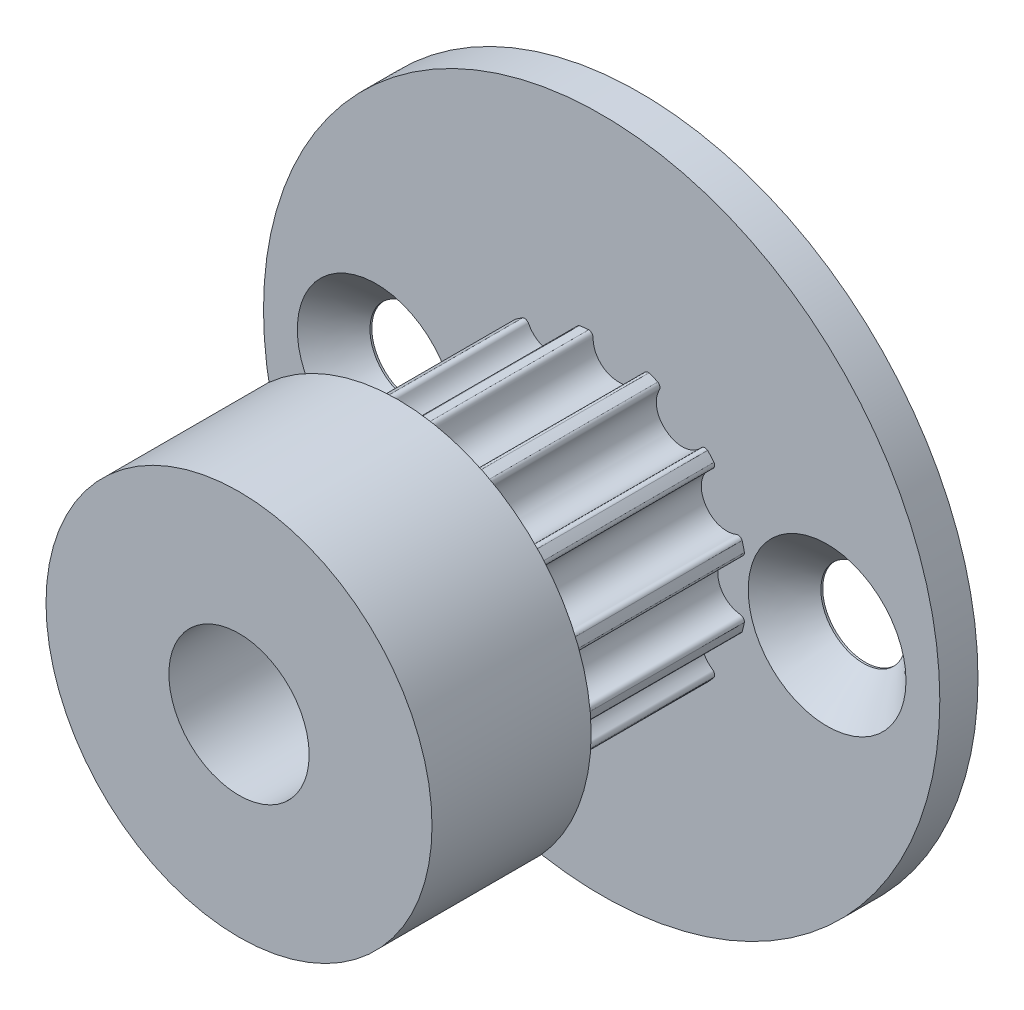
from build123d import *

# Parameters (mm, degrees)
TOOTHEXTRUDECUTGEARBELT01_DEPTH                = 3.75179993
PATTERNGEARBELT01_COUNT                        = 13
BOSS_EXTRUDE2_START                            = -0.903259633
BOSS_EXTRUDE2_OUTLINE_R                        = 7.705197088
BOSS_EXTRUDE2_OUTLINE_R_2                      = 5.190597126
BOSS_EXTRUDE2_DEPTH                            = 0.903259633
SKETCH6_R                                      = 7.705197088
BOSS_EXTRUDE4_DEPTH                            = 5.45
SKETCH8_R                                      = 2.8
CUT_EXTRUDE2_DEPTH                             = 20.3595279
SKETCH10_R                                     = 13.5
SKETCH10_R_2                                   = 1.5
BOSS_EXTRUDE5_DEPTH                            = 1.524
SKETCH10_2_R                                   = 1.5
CUT_EXTRUDE6_DEPTH                             = 1.524
CSK_FOR_M3_FLAT_HEAD_MACHINE_SCREW1_AT_2_COUNT = 2
CSK_FOR_M3_FLAT_HEAD_MACHINE_SCREW1_AT_2_PITCH = 18


# Read off the part's stored shape, not the designer's step: Boss-Extrude2
with BuildPart() as part:
    # SketchRevolveGearBelt01 → GearBelt01 (revolve)
    with BuildSketch(Plane(origin=(0, 0, 0), x_dir=(0, 0, -1), z_dir=(1, 0, 0)), mode=Mode.PRIVATE) as gearbelt01_sk:
        Polygon((5.2757999, 0), (5.2757999, 5.190597126), (4.51379992, 5.190597126), (4.51379992, 6.055025889), (5.07653656, 7.413592317), (4.372540367, 7.705197088), (3.75179993, 6.206597107), (3.75179993, 5.825597113), (-3.75179993, 5.825597113), (-3.75179993, 6.206597107), (-4.372540367, 7.705197088), (-5.07653656, 7.413592317), (-4.51379992, 6.055025889), (-4.51379992, 5.190597126), (-5.2757999, 5.190597126), (-5.2757999, 0), align=None)
    revolve(gearbelt01_sk.sketch.rotate(Axis((0, 0, 0), (0, 0, -1)), 90), axis=Axis((0, 0, 0), (0, 0, -1)))

    # SketchToothGearBelt01 → ToothExtrudeCutGearBelt01 (cut, symmetric)
    with BuildSketch(Plane.XY):
        with BuildLine():
            ThreePointArc((5.694892079, 1.238985826), (5.82811133, 0), (5.694892079, -1.238985826))
            add(Edge.make_bspline(
                [(5.694892079, -1.238985826), (5.697177057, -1.228489495), (5.699194946, -1.212438974), (5.699015589, -1.190934318), (5.697447837, -1.174881659), (5.694459096, -1.159031946), (5.690073082, -1.143510711), (5.684324518, -1.128440876), (5.677258937, -1.113941791), (5.668932293, -1.100128287), (5.659410534, -1.087109759), (5.648769066, -1.07498933), (5.637092178, -1.063862917), (5.624472313, -1.053818916), (5.611009544, -1.044935833), (5.596810022, -1.03728791), (5.58198796, -1.030921195), (5.566654196, -1.025940308), (5.55095461, -1.022182426), (5.517566972, -1.018537534), (5.464967856, -1.005661424), (5.391433133, -0.99322849), (5.316880193, -0.971191628), (5.244078819, -0.944232687), (5.173663428, -0.911435203), (5.106015211, -0.873290054), (5.04156233, -0.829953387), (4.980696233, -0.781711646), (4.923790969, -0.728854955), (4.87119508, -0.671708794), (4.823231033, -0.610623043), (4.780192773, -0.545972238), (4.74234423, -0.478152621), (4.709916952, -0.407579931), (4.683111362, -0.334686642), (4.662085571, -0.259919934), (4.646991584, -0.183736684), (4.637835603, -0.106609111), (4.635765562, -0.050027961), (4.635859666, -0.014500084), (4.635846864, 0), (4.635859666, 0.014500084), (4.635765562, 0.050027961), (4.637835603, 0.106609111), (4.646991584, 0.183736684), (4.662085571, 0.259919934), (4.683111362, 0.334686642), (4.709916952, 0.407579931), (4.74234423, 0.478152621), (4.780192773, 0.545972238), (4.823231033, 0.610623043), (4.87119508, 0.671708794), (4.923790969, 0.728854955), (4.980696233, 0.781711646), (5.04156233, 0.829953387), (5.106015211, 0.873290054), (5.173663428, 0.911435203), (5.244078819, 0.944232687), (5.316880193, 0.971191628), (5.391433133, 0.99322849), (5.464967856, 1.005661424), (5.517566972, 1.018537534), (5.55095461, 1.022182426), (5.566654196, 1.025940308), (5.58198796, 1.030921195), (5.596810022, 1.03728791), (5.611009544, 1.044935833), (5.624472313, 1.053818916), (5.637092178, 1.063862917), (5.648769066, 1.07498933), (5.659410534, 1.087109759), (5.668932293, 1.100128287), (5.677258937, 1.113941791), (5.684324518, 1.128440876), (5.690073082, 1.143510711), (5.694459096, 1.159031946), (5.697447837, 1.174881659), (5.699015589, 1.190934318), (5.699194946, 1.212438974), (5.697177057, 1.228489495), (5.694892079, 1.238985826)],
                knots=[0, 0, 0, 0, 0.008948615, 0.013422922, 0.01789723, 0.022371537, 0.026845844, 0.031320152, 0.035794459, 0.040268767, 0.044743074, 0.049217381, 0.053691689, 0.058165996, 0.062640304, 0.067114611, 0.071588919, 0.076063226, 0.080537533, 0.085011841, 0.104016804, 0.125568346, 0.147119888, 0.168671431, 0.190222973, 0.211774515, 0.233326058, 0.2548776, 0.276429142, 0.297980685, 0.319532227, 0.341083769, 0.362635312, 0.384186854, 0.405738396, 0.427289939, 0.448841481, 0.470393024, 0.491944566, 0.495972283, 0.5, 0.504027717, 0.508055434, 0.529606976, 0.551158519, 0.572710061, 0.594261604, 0.615813146, 0.637364688, 0.658916231, 0.680467773, 0.702019315, 0.723570858, 0.7451224, 0.766673942, 0.788225485, 0.809777027, 0.831328569, 0.852880112, 0.874431654, 0.895983196, 0.914988159, 0.919462467, 0.923936774, 0.928411081, 0.932885389, 0.937359696, 0.941834004, 0.946308311, 0.950782619, 0.955256926, 0.959731233, 0.964205541, 0.968679848, 0.973154156, 0.977628463, 0.98210277, 0.986577078, 0.991051385, 1, 1, 1, 1], degree=3))
        make_face()
    toothextrudecutgearbelt01 = extrude(amount=TOOTHEXTRUDECUTGEARBELT01_DEPTH, both=True, mode=Mode.SUBTRACT)

    # PatternGearBelt01: ToothExtrudeCutGearBelt01 ×13 about axis
    patterngearbelt01_axis = Axis((0, 0, 55), (0, 0, -1))
    for i in range(1, PATTERNGEARBELT01_COUNT):
        add(toothextrudecutgearbelt01.rotate(patterngearbelt01_axis, i * 360 / PATTERNGEARBELT01_COUNT), mode=Mode.SUBTRACT)

    # Boss-Extrude2 outline → Boss-Extrude2 (add)
    with BuildSketch(Plane(origin=(0, 0, -5.2757999), x_dir=(-1, 0, 0), z_dir=(0, 0, -1)).offset(BOSS_EXTRUDE2_START)):
        Circle(BOSS_EXTRUDE2_OUTLINE_R)
        Circle(BOSS_EXTRUDE2_OUTLINE_R_2, mode=Mode.SUBTRACT)
    boss_extrude2 = extrude(amount=BOSS_EXTRUDE2_DEPTH)

    # Mirror1: Boss-Extrude2 across plane
    add(boss_extrude2.mirror(Plane.XY))

    # Sketch6 → Boss-Extrude4 (add)
    with BuildSketch(Plane.XY.offset(5.2757999)):
        with Locations(Location((0, 0, 0), (0, 0, 180))):
            Circle(SKETCH6_R)
    extrude(amount=BOSS_EXTRUDE4_DEPTH)

    # Sketch8 → Cut-Extrude2 (cut, through all)
    with BuildSketch(Plane.XY.offset(10.7257999)):
        Circle(SKETCH8_R)
    extrude(amount=-CUT_EXTRUDE2_DEPTH, mode=Mode.SUBTRACT)

    # Sketch10 → Boss-Extrude5 (add)
    with BuildSketch(Plane.XY.offset(-3.75179993)):
        Circle(SKETCH10_R)
        with Locations((-9, 0)):
            Circle(SKETCH10_R_2, mode=Mode.SUBTRACT)
        with Locations((9, 0)):
            Circle(SKETCH10_R_2, mode=Mode.SUBTRACT)
    extrude(amount=-BOSS_EXTRUDE5_DEPTH)

    # Sketch10<2> → Cut-Extrude6 (cut)
    with BuildSketch(Plane.XY.offset(-3.75179993)):
        with Locations((-9, 0)):
            Circle(SKETCH10_2_R)
        with Locations((9, 0)):
            Circle(SKETCH10_2_R)
    extrude(amount=-CUT_EXTRUDE6_DEPTH, mode=Mode.SUBTRACT)

    # Sketch12 → CSK for M3 Flat Head Machine Screw1 (revolve, cut)
    with BuildSketch(Plane(origin=(-9, 0, -3.75179993), x_dir=(0, -1, 0), z_dir=(1, 0, 0))):
        Polygon((0, 0), (0, 1.524), (1.7, 1.524), (1.7, 1.45), (3.15, 0), align=None)
    csk_for_m3_flat_head_machine_screw1 = revolve(axis=Axis((-9, 0, 2.59820007), (0, 0, -1)), mode=Mode.SUBTRACT)

    # CSK for M3 Flat Head Machine Screw1 at 2: CSK for M3 Flat Head Machine Screw1 ×2
    with Locations(*[(i * CSK_FOR_M3_FLAT_HEAD_MACHINE_SCREW1_AT_2_PITCH, 0, 0) for i in range(1, CSK_FOR_M3_FLAT_HEAD_MACHINE_SCREW1_AT_2_COUNT)]):
        add(csk_for_m3_flat_head_machine_screw1, mode=Mode.SUBTRACT)


solid = part.part
